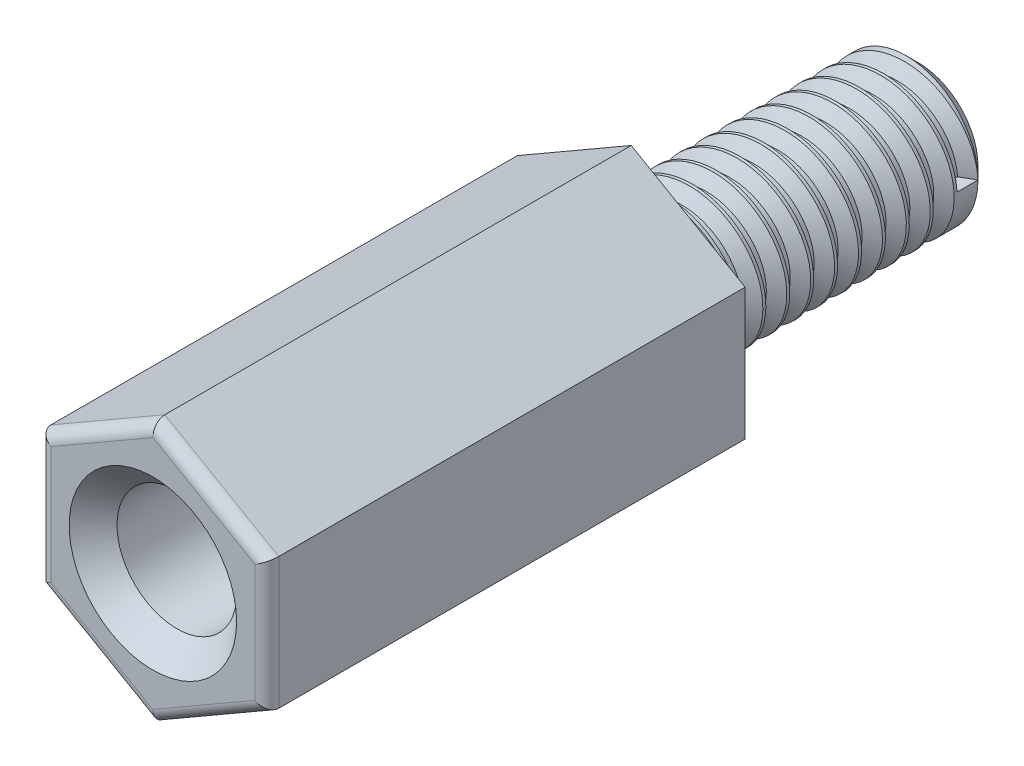
from build123d import *

# Parameters (mm, degrees)
EXTRUDE_1_DEPTH             = 10
SKETCH_2_R                  = 1.5
EXTRUDE_2_DEPTH             = 6
HOLE_WIZARD_M31_D           = 2.5
HOLE_WIZARD_M31_DEPTH       = 8.5
HOLE_WIZARD_M31_CSINK_D     = 3.5
HOLE_WIZARD_M31_CSINK_ANGLE = 90
HOLE_WIZARD_M31_TIP         = 0.751075774
FILLET_1_R                  = 0.25
CHAMFER_1_SIZE              = 0.25
THREAD_1_PITCH              = 0.5


with BuildPart() as part:
    # Sketch 1 → Бобышка-Вытянуть1 (new body)
    with BuildSketch(Plane.XY):
        Polygon((0, 2.75), (-2.38156986, 1.375), (-2.38156986, -1.375), (0, -2.75), (2.38156986, -1.375), (2.38156986, 1.375), align=None)
    extrude(amount=EXTRUDE_1_DEPTH)

    # Эскиз2 → Бобышка-Вытянуть2 (add)
    with BuildSketch(Plane(origin=(0, 0, 0), x_dir=(-1, 0, 0), z_dir=(0, 0, -1))):
        Circle(SKETCH_2_R)
    extrude(amount=EXTRUDE_2_DEPTH)

    # Отверстие обработанное метчиком M31
    with Locations(Plane.XY.offset(10)):
        with Locations((0, 0)):
            CounterSinkHole(HOLE_WIZARD_M31_D / 2, HOLE_WIZARD_M31_CSINK_D / 2, depth=HOLE_WIZARD_M31_DEPTH, counter_sink_angle=HOLE_WIZARD_M31_CSINK_ANGLE)
            with Locations((0, 0, -(HOLE_WIZARD_M31_DEPTH + HOLE_WIZARD_M31_TIP / 2))):  # 118° drill point
                Cone(0, HOLE_WIZARD_M31_D / 2, HOLE_WIZARD_M31_TIP, mode=Mode.SUBTRACT)

    # Скругление1
    fillet_1_edges = [part.edges().sort_by_distance(p)[0] for p in [
        (-2.38156986, 0, 10),
        (-1.19078493, -2.0625, 10),
        (1.19078493, -2.0625, 10),
        (2.38156986, 0, 10),
        (1.19078493, 2.0625, 10),
        (-1.19078493, 2.0625, 10),
    ]]
    fillet(fillet_1_edges, radius=FILLET_1_R)

    # Фаска1
    chamfer_1_edges = [part.edges().sort_by_distance(p)[0] for p in [
        (1.5, 0, -6),
    ]]
    chamfer(chamfer_1_edges, length=CHAMFER_1_SIZE)

    # Резьба1: the profile of Sketch 1 2 profile screwed along a right-hand helix of 12 turns, 6 arcs to a turn; built about Z, then put on its axis
    thread_1_z = Axis((0, 0, 0), (0, 0, 1))
    thread_1_corners = [(1.5003, 0, -0.000173205), (1.5003, 0, 0.437673204), (1.229367063, 0, 0.281249999), (1.229367063, 0, 0.156249999)]
    with BuildLine(mode=Mode.PRIVATE) as thread_1_profile:
        Line(thread_1_corners[0], thread_1_corners[1])
        Line(thread_1_corners[1], thread_1_corners[2])
        Line(thread_1_corners[2], thread_1_corners[3])
        Line(thread_1_corners[3], thread_1_corners[0])
    thread_1_cap = Face(thread_1_profile.wire())
    thread_1_turn_angles = [0, 30, 60, 90, 120, 150, 180, 210, 240, 270, 300, 330, 360]
    thread_1_turn_weights = [1, 0.8660254037844387, 1, 0.8660254037844387, 1, 0.8660254037844387, 1, 0.8660254037844387, 1, 0.8660254037844387, 1, 0.8660254037844387, 1]
    thread_1_turn_rails = [Edge.make_bspline([Vector(p[0], p[1], 0).rotate(thread_1_z, thread_1_turn_angles[k]) / thread_1_turn_weights[k] + Vector(0, 0, p[2] + THREAD_1_PITCH * thread_1_turn_angles[k] / 360) for k in range(13)], [0, 0, 0, 1, 1, 2, 2, 3, 3, 4, 4, 5, 5, 6, 6, 6], 2, thread_1_turn_weights) for p in thread_1_corners]
    thread_1_turn_sides = [Face.make_surface_from_curves(thread_1_turn_rails[p[0]], thread_1_turn_rails[p[1]]) for p in [(0, 1), (1, 2), (2, 3), (3, 0)]]
    thread_1 = Plane(origin=(0, 0, -5.75), x_dir=(1, 0, 0), z_dir=(0, 0, 1)) * Solid(Shell([*[p.moved(Location((0, 0, THREAD_1_PITCH * i))) for i in range(12) for p in thread_1_turn_sides], thread_1_cap, thread_1_cap.rotate(thread_1_z, 4320).moved(Location((0, 0, THREAD_1_PITCH * 4320 / 360)))]))
    add(thread_1, mode=Mode.SUBTRACT)


solid = part.part
